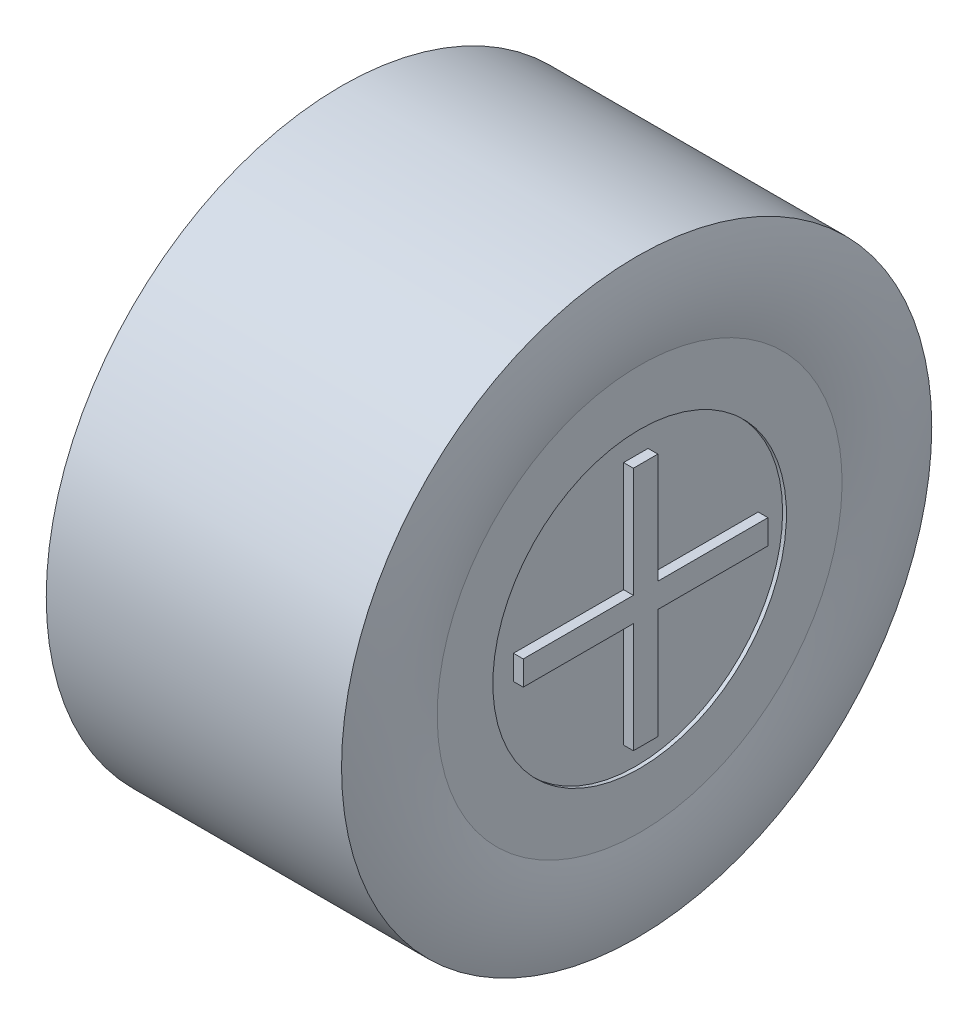
from build123d import *

# Parameters (mm, degrees)
REVOLVE_1_OUTLINE_W   = 0.355269541
REVOLVE_1_OUTLINE_H   = 0.438478825
REVOLVE_1_OUTLINE_W_2 = 11.364624133
REVOLVE_1_OUTLINE_W_3 = 4.372569082
REVOLVE_1_OUTLINE_H_2 = 55.75634902
REVOLVE_1_OUTLINE_H_3 = 1.854936884
REVOLVE_1_OUTLINE_W_4 = 14.211965544
REVOLVE_1_OUTLINE_H_4 = 0.61022171
SKETCH_2_R            = 30
EXTRUDE_1_DEPTH       = 30
SKETCH_3_R            = 8
EXTRUDE_2_DEPTH       = 30
SKETCH_4_W            = 5
SKETCH_4_H            = 22.5
SKETCH_4_W_2          = 22.5
SKETCH_4_H_2          = 5
EXTRUDE_3_DEPTH       = 2


# Read off the part's stored shape, not the designer's step: 회전1
with BuildPart() as part:
    # 회전1 outline → 회전1 (revolve)
    with BuildSketch(Plane.YX):
        with Locations((41.542258903, -28.097413923)):
            Rectangle(REVOLVE_1_OUTLINE_W, REVOLVE_1_OUTLINE_H)
        with BuildLine():
            add(Edge.make_bspline(
                [(41.719893674, -27.87817451), (41.894749248, -27.921618592), (42.252720208, -28.01137838), (42.873298399, -28.15700866), (43.341279515, -28.256769587), (43.642191366, -28.316653335)],
                knots=[0.117139278, 0.117139278, 0.117139278, 0.117139278, 0.14529069, 0.173442101, 0.224513922, 0.224513922, 0.224513922, 0.224513922], degree=3))
            Line((41.719893674, -27.87817451), (41.719893674, -28.316653335))
            Line((41.719893674, -28.316653335), (43.642191366, -28.316653335))
        make_face()
        with BuildLine():
            add(Edge.make_bspline(
                [(43.642191366, -28.316653335), (43.673012094, -28.322786894), (44.367114713, -28.459908676), (46.367881136, -28.788520691), (49.637320271, -29.015805628), (53.021708434, -28.821695589), (55.131271584, -28.478533008), (55.931859218, -28.316653335)],
                knots=[0.224513922, 0.224513922, 0.224513922, 0.224513922, 0.229744924, 0.34235057, 0.567561862, 0.792773154, 0.932194296, 0.932194296, 0.932194296, 0.932194296], degree=3))
            Line((43.642191366, -28.316653335), (41.719893674, -28.316653335))
            Line((41.719893674, -28.316653335), (41.719893674, -30.171590219))
            Line((41.719893674, -30.171590219), (55.931859218, -30.171590219))
            Line((55.931859218, -30.171590219), (55.931859218, -28.316653335))
        make_face()
        with Locations((35.682312067, -28.097413923)):
            Rectangle(REVOLVE_1_OUTLINE_W_2, REVOLVE_1_OUTLINE_H)
        with Locations((58.118143759, -28.097413923)):
            Rectangle(REVOLVE_1_OUTLINE_W_3, REVOLVE_1_OUTLINE_H)
        with Locations((58.118143759, 0)):
            Rectangle(REVOLVE_1_OUTLINE_W_3, REVOLVE_1_OUTLINE_H_2)
        with BuildLine():
            Line((41.719893674, 28.316653335), (41.719893674, 27.87817451))
            add(Edge.make_bspline(
                [(43.128876316, 28.316653335), (42.973861456, 28.272694047), (42.669494175, 28.183372992), (42.227403007, 28.044794313), (41.884836208, 27.931979132), (41.719893674, 27.87817451)],
                knots=[0.937972384, 0.937972384, 0.937972384, 0.937972384, 0.966974102, 0.995182728, 1.023391355, 1.023391355, 1.023391355, 1.023391355], degree=3))
            Line((43.128876316, 28.316653335), (41.719893674, 28.316653335))
        make_face()
        with Locations((41.542258903, 28.097413923)):
            Rectangle(REVOLVE_1_OUTLINE_W, REVOLVE_1_OUTLINE_H)
        with Locations((41.542258903, -29.244121777)):
            Rectangle(REVOLVE_1_OUTLINE_W, REVOLVE_1_OUTLINE_H_3)
        with Locations((58.118143759, -29.244121777)):
            Rectangle(REVOLVE_1_OUTLINE_W_3, REVOLVE_1_OUTLINE_H_3)
        with Locations((35.682312067, -29.244121777)):
            Rectangle(REVOLVE_1_OUTLINE_W_2, REVOLVE_1_OUTLINE_H_3)
        with Locations((35.682312067, 28.097413923)):
            Rectangle(REVOLVE_1_OUTLINE_W_2, REVOLVE_1_OUTLINE_H)
        with Locations((58.118143759, 28.097413923)):
            Rectangle(REVOLVE_1_OUTLINE_W_3, REVOLVE_1_OUTLINE_H)
        with BuildLine():
            Line((41.719893674, 28.316653335), (43.128876316, 28.316653335))
            add(Edge.make_bspline(
                [(55.931859218, 28.316653335), (55.350466054, 28.484554725), (54.483083768, 28.700477141), (53.332821917, 28.919070087), (52.621816991, 29.026887301), (51.140275095, 29.207221888), (48.779721438, 29.304602769), (45.95584246, 28.998713875), (44.028351242, 28.564756145), (43.275412999, 28.358208372), (43.128876316, 28.316653335)],
                knots=[0.120715306, 0.120715306, 0.120715306, 0.120715306, 0.233549812, 0.285972839, 0.342390092, 0.370598718, 0.57205333, 0.797722342, 0.910556849, 0.937972384, 0.937972384, 0.937972384, 0.937972384], degree=3))
            Line((55.931859218, 28.316653335), (55.931859218, 30.171590219))
            Line((55.931859218, 30.171590219), (41.719893674, 30.171590219))
            Line((41.719893674, 30.171590219), (41.719893674, 28.316653335))
        make_face()
        with Locations((41.542258903, 29.244121777)):
            Rectangle(REVOLVE_1_OUTLINE_W, REVOLVE_1_OUTLINE_H_3)
        with Locations((48.825876446, -30.476701074)):
            Rectangle(REVOLVE_1_OUTLINE_W_4, REVOLVE_1_OUTLINE_H_4)
        with Locations((41.542258903, -30.476701074)):
            Rectangle(REVOLVE_1_OUTLINE_W, REVOLVE_1_OUTLINE_H_4)
        with BuildLine():
            Line((60.3044283, -30.171590219), (55.931859218, -30.171590219))
            Line((55.931859218, -30.171590219), (55.931859218, -30.781811929))
            Line((55.931859218, -30.781811929), (58.176696805, -30.781811929))
            add(Edge.make_bspline(
                [(60.3044283, -30.171590219), (59.242057092, -30.511353598), (58.176696805, -30.781811929)],
                knots=[0, 0, 0, 0.113573553, 0.113573553, 0.113573553], degree=2))
        make_face()
        with Locations((35.682312067, -30.476701074)):
            Rectangle(REVOLVE_1_OUTLINE_W_2, REVOLVE_1_OUTLINE_H_4)
        with Locations((35.682312067, 29.244121777)):
            Rectangle(REVOLVE_1_OUTLINE_W_2, REVOLVE_1_OUTLINE_H_3)
        with Locations((58.118143759, 29.244121777)):
            Rectangle(REVOLVE_1_OUTLINE_W_3, REVOLVE_1_OUTLINE_H_3)
        with Locations((41.542258903, 30.476701074)):
            Rectangle(REVOLVE_1_OUTLINE_W, REVOLVE_1_OUTLINE_H_4)
        with Locations((48.825876446, 30.476701074)):
            Rectangle(REVOLVE_1_OUTLINE_W_4, REVOLVE_1_OUTLINE_H_4)
        with BuildLine():
            Line((55.931859218, -30.781811929), (41.719893674, -30.781811929))
            Line((41.719893674, -30.781811929), (41.719893674, -30.868243844))
            add(Edge.make_bspline(
                [(49.816181075, -31.837257545), (45.788933817, -31.837257541), (41.719893674, -30.868243844)],
                knots=[0.556786778, 0.556786778, 0.556786778, 0.981464752, 0.981464752, 0.981464752], degree=2))
            add(Edge.make_bspline(
                [(55.931859218, -31.274158213), (52.886163188, -31.837257547), (49.816181075, -31.837257545)],
                knots=[0.233053543, 0.233053543, 0.233053543, 0.556786778, 0.556786778, 0.556786778], degree=2))
            Line((55.931859218, -31.274158213), (55.931859218, -30.781811929))
        make_face()
        with BuildLine():
            Line((41.719893674, -30.868243844), (41.719893674, -30.781811929))
            Line((41.719893674, -30.781811929), (41.364624133, -30.781811929))
            add(Edge.make_bspline(
                [(41.719893674, -30.868243844), (41.54229871, -30.825950834), (41.364624133, -30.781811929)],
                knots=[0.981464752, 0.981464752, 0.981464752, 1, 1, 1], degree=2))
        make_face()
        with BuildLine():
            Line((58.176696805, -30.781811929), (55.931859218, -30.781811929))
            Line((55.931859218, -30.781811929), (55.931859218, -31.274158213))
            add(Edge.make_bspline(
                [(58.176696805, -30.781811929), (57.055932041, -31.066335551), (55.931859218, -31.274158213)],
                knots=[0.113573553, 0.113573553, 0.113573553, 0.233053543, 0.233053543, 0.233053543], degree=2))
        make_face()
        with Locations((35.682312067, 30.476701074)):
            Rectangle(REVOLVE_1_OUTLINE_W_2, REVOLVE_1_OUTLINE_H_4)
        with BuildLine():
            Line((55.931859218, 30.781811929), (55.931859218, 30.171590219))
            Line((55.931859218, 30.171590219), (60.3044283, 30.171590219))
            add(Edge.make_bspline(
                [(58.176696805, 30.781811929), (59.242057092, 30.511353598), (60.3044283, 30.171590219)],
                knots=[0.886426447, 0.886426447, 0.886426447, 1, 1, 1], degree=2))
            Line((58.176696805, 30.781811929), (55.931859218, 30.781811929))
        make_face()
        with BuildLine():
            Line((41.364624133, 30.781811929), (41.719893674, 30.781811929))
            Line((41.719893674, 30.781811929), (41.719893674, 30.868243844))
            add(Edge.make_bspline(
                [(41.364624133, 30.781811929), (41.54229871, 30.825950834), (41.719893674, 30.868243844)],
                knots=[0, 0, 0, 0.018535248, 0.018535248, 0.018535248], degree=2))
        make_face()
        with BuildLine():
            Line((41.719893674, 30.868243844), (41.719893674, 30.781811929))
            Line((41.719893674, 30.781811929), (55.931859218, 30.781811929))
            Line((55.931859218, 30.781811929), (55.931859218, 31.274158213))
            add(Edge.make_bspline(
                [(49.816181262, 31.837257545), (52.886163281, 31.83725753), (55.931859218, 31.274158213)],
                knots=[0.443213232, 0.443213232, 0.443213232, 0.766946457, 0.766946457, 0.766946457], degree=2))
            add(Edge.make_bspline(
                [(41.719893674, 30.868243844), (45.788933912, 31.837257564), (49.816181262, 31.837257545)],
                knots=[0.018535248, 0.018535248, 0.018535248, 0.443213232, 0.443213232, 0.443213232], degree=2))
        make_face()
        with BuildLine():
            Line((55.931859218, 31.274158213), (55.931859218, 30.781811929))
            Line((55.931859218, 30.781811929), (58.176696805, 30.781811929))
            add(Edge.make_bspline(
                [(55.931859218, 31.274158213), (57.055932041, 31.066335551), (58.176696805, 30.781811929)],
                knots=[0.766946457, 0.766946457, 0.766946457, 0.886426447, 0.886426447, 0.886426447], degree=2))
        make_face()
    revolve(axis=Axis((0, 0, 0), (1, 0, 0)))

    # 스케치2 → 보스-돌출1 (add, symmetric)
    with BuildSketch(Plane(origin=(0, 0, 0), x_dir=(0, 0, -1), z_dir=(1, 0, 0))):
        with Locations(Location((0, 0, 0), (0, 0, 270))):
            Circle(SKETCH_2_R)
    extrude(amount=EXTRUDE_1_DEPTH, both=True)

    # 스케치3 → 보스-돌출2 (add)
    with BuildSketch(Plane.ZY.offset(30)):
        with Locations(Location((0, 0, 0), (0, 0, 180))):
            Circle(SKETCH_3_R)
    extrude(amount=EXTRUDE_2_DEPTH)

    # 스케치4 → 보스-돌출3 (add)
    with BuildSketch(Plane(origin=(30, 0, 0), x_dir=(0, 0, -1), z_dir=(1, 0, 0))):
        with Locations((0, 13.75)):
            Rectangle(SKETCH_4_W, SKETCH_4_H)
        with Locations((-13.75, 0)):
            Rectangle(SKETCH_4_W_2, SKETCH_4_H_2)
        Rectangle(SKETCH_4_W, SKETCH_4_H_2)
        with Locations((13.75, 0)):
            Rectangle(SKETCH_4_W_2, SKETCH_4_H_2)
        with Locations((0, -13.75)):
            Rectangle(SKETCH_4_W, SKETCH_4_H)
    extrude(amount=EXTRUDE_3_DEPTH)


solid = part.part
